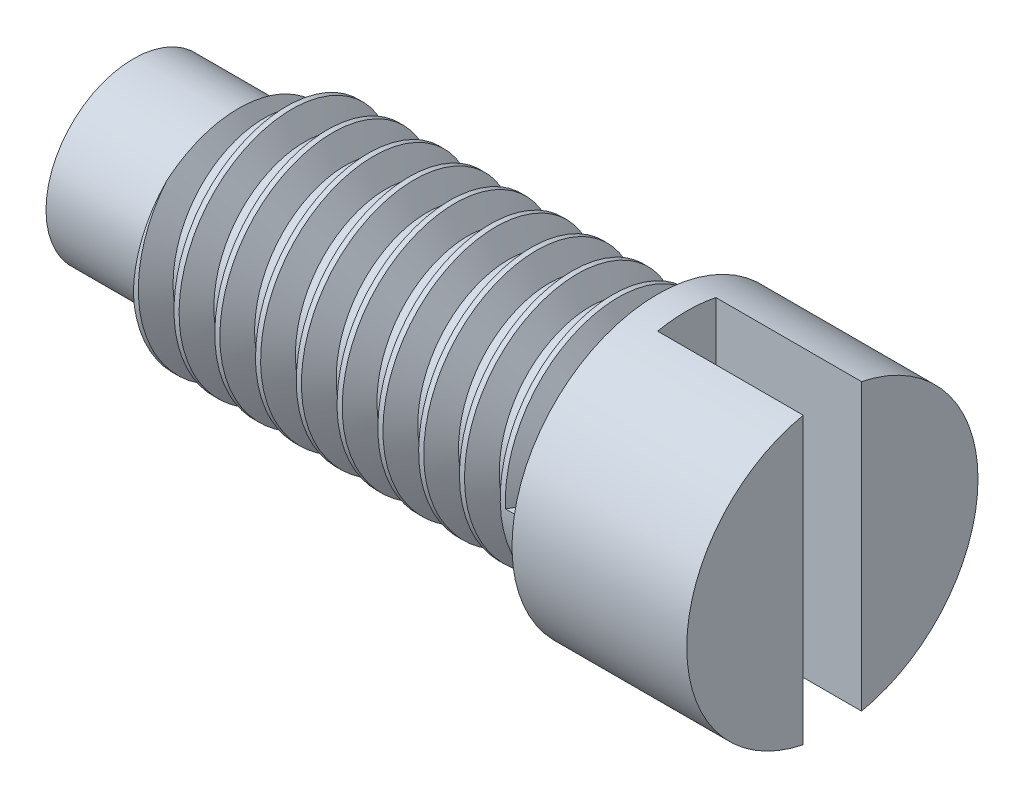
from build123d import *

# Parameters (mm, degrees)
SKETCH2_W          = 1
SKETCH2_H          = 7.339285714
CUT_EXTRUDE1_DEPTH = 2.5
THREAD1_PITCH      = 0.7


with BuildPart() as part:
    # Sketch1 → Revolve1 (revolve)
    with BuildSketch(Plane.XY):
        Polygon((0, 0), (0, 1.5), (2, 1.5), (2, 2), (9, 2), (9, 2.5), (12, 2.5), (12, 0), align=None)
    revolve(axis=Axis((12, 0, 0), (-1, 0, 0)))

    # Sketch2 → Cut-Extrude1 (cut)
    with BuildSketch(Plane(origin=(12, 0, 0), x_dir=(0, 0, -1), z_dir=(1, 0, 0))):
        Rectangle(SKETCH2_W, SKETCH2_H)
    extrude(amount=-CUT_EXTRUDE1_DEPTH, mode=Mode.SUBTRACT)

    # Thread1: the profile of Thread Profile1 profile screwed along a right-hand helix of 10 turns, 6 arcs to a turn; built about Z, then put on its axis
    thread1_z = Axis((0, 0, 0), (0, 0, 1))
    thread1_corners = [(2.0003, 0, -0.000173205), (2.0003, 0, 0.612673203), (1.621113887, 0, 0.393749999), (1.621113887, 0, 0.218749999)]
    with BuildLine(mode=Mode.PRIVATE) as thread1_profile:
        Line(thread1_corners[0], thread1_corners[1])
        Line(thread1_corners[1], thread1_corners[2])
        Line(thread1_corners[2], thread1_corners[3])
        Line(thread1_corners[3], thread1_corners[0])
    thread1_cap = Face(thread1_profile.wire())
    thread1_turn_angles = [0, 30, 60, 90, 120, 150, 180, 210, 240, 270, 300, 330, 360]
    thread1_turn_weights = [1, 0.8660254037844387, 1, 0.8660254037844387, 1, 0.8660254037844387, 1, 0.8660254037844387, 1, 0.8660254037844387, 1, 0.8660254037844387, 1]
    thread1_turn_rails = [Edge.make_bspline([Vector(p[0], p[1], 0).rotate(thread1_z, thread1_turn_angles[k]) / thread1_turn_weights[k] + Vector(0, 0, p[2] + THREAD1_PITCH * thread1_turn_angles[k] / 360) for k in range(13)], [0, 0, 0, 1, 1, 2, 2, 3, 3, 4, 4, 5, 5, 6, 6, 6], 2, thread1_turn_weights) for p in thread1_corners]
    thread1_turn_sides = [Face.make_surface_from_curves(thread1_turn_rails[p[0]], thread1_turn_rails[p[1]]) for p in [(0, 1), (1, 2), (2, 3), (3, 0)]]
    thread1 = Plane(origin=(9, 0, 0), x_dir=(0, 0, 1), z_dir=(-1, 0, 0)) * Solid(Shell([*[p.moved(Location((0, 0, THREAD1_PITCH * i))) for i in range(10) for p in thread1_turn_sides], thread1_cap, thread1_cap.rotate(thread1_z, 3600).moved(Location((0, 0, THREAD1_PITCH * 3600 / 360)))]))
    add(thread1, mode=Mode.SUBTRACT)


solid = part.part
